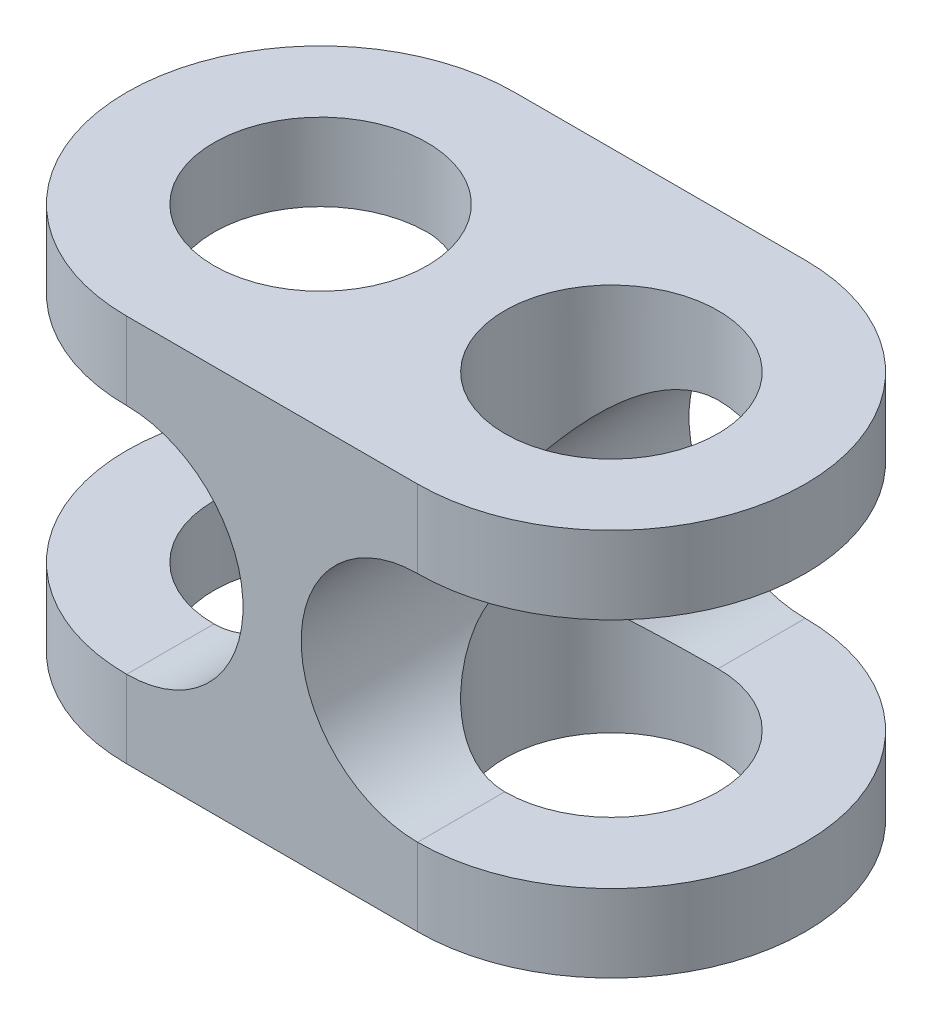
from build123d import *

# Parameters (mm, degrees)
SKETCH1_R                      = 2.75
BOSS_EXTRUDE1_DEPTH            = 10
CUT_EXTRUDE1_REACH             = 18.771
CUT_EXTRUDE1_DIRECTION_2_REACH = 18.771


with BuildPart() as part:
    # Sketch1 → Boss-Extrude1 (new body)
    with BuildSketch(Plane(origin=(0, 0, 0), x_dir=(1, 0, 0), z_dir=(0, 1, 0))):
        with BuildLine():
            Line((0, 5), (7.5, 5))
            ThreePointArc((7.5, 5), (12.5, 0), (7.5, -5))
            Line((7.5, -5), (0, -5))
            ThreePointArc((0, -5), (-5, 0), (0, 5))
        make_face()
        Circle(SKETCH1_R, mode=Mode.SUBTRACT)
        with Locations((7.5, 0)):
            Circle(SKETCH1_R, mode=Mode.SUBTRACT)
    extrude(amount=BOSS_EXTRUDE1_DEPTH)

    # Sketch2 → Cut-Extrude1 (cut, up to next)
    with BuildSketch(Plane.XY, mode=Mode.PRIVATE) as cut_extrude1_sk1:
        with BuildLine():
            Line((0, 8), (-5, 8))
            Line((-5, 8), (-5, 2))
            Line((-5, 2), (0, 2))
            ThreePointArc((0, 2), (3, 5), (0, 8))
        make_face()
    cut_extrude1_tool1 = extrude(cut_extrude1_sk1.sketch, amount=-CUT_EXTRUDE1_REACH, mode=Mode.PRIVATE) & part.part
    # Sketch2 → Cut-Extrude1 (cut, up to next)
    with BuildSketch(Plane.XY, mode=Mode.PRIVATE) as cut_extrude1_sk2:
        with BuildLine():
            Line((7.5, 8), (12.5, 8))
            Line((12.5, 8), (12.5, 2))
            Line((12.5, 2), (7.5, 2))
            ThreePointArc((7.5, 2), (4.5, 5), (7.5, 8))
        make_face()
    cut_extrude1_tool2 = extrude(cut_extrude1_sk2.sketch, amount=-CUT_EXTRUDE1_REACH, mode=Mode.PRIVATE) & part.part
    add(cut_extrude1_tool1.solids().sort_by_distance((-1.291429, 5, 0))[0], mode=Mode.SUBTRACT)
    add(cut_extrude1_tool2.solids().sort_by_distance((8.791429, 5, 0))[0], mode=Mode.SUBTRACT)

    # Sketch2 → Cut-Extrude1 direction 2 (cut, up to next)
    with BuildSketch(Plane.XY, mode=Mode.PRIVATE) as cut_extrude1_direction_2_sk1:
        with BuildLine():
            Line((0, 8), (-5, 8))
            Line((-5, 8), (-5, 2))
            Line((-5, 2), (0, 2))
            ThreePointArc((0, 2), (3, 5), (0, 8))
        make_face()
    cut_extrude1_direction_2_tool1 = extrude(cut_extrude1_direction_2_sk1.sketch, amount=CUT_EXTRUDE1_DIRECTION_2_REACH, mode=Mode.PRIVATE) & part.part
    # Sketch2 → Cut-Extrude1 direction 2 (cut, up to next)
    with BuildSketch(Plane.XY, mode=Mode.PRIVATE) as cut_extrude1_direction_2_sk2:
        with BuildLine():
            Line((7.5, 8), (12.5, 8))
            Line((12.5, 8), (12.5, 2))
            Line((12.5, 2), (7.5, 2))
            ThreePointArc((7.5, 2), (4.5, 5), (7.5, 8))
        make_face()
    cut_extrude1_direction_2_tool2 = extrude(cut_extrude1_direction_2_sk2.sketch, amount=CUT_EXTRUDE1_DIRECTION_2_REACH, mode=Mode.PRIVATE) & part.part
    add(cut_extrude1_direction_2_tool1.solids().sort_by_distance((-1.291429, 5, 0))[0], mode=Mode.SUBTRACT)
    add(cut_extrude1_direction_2_tool2.solids().sort_by_distance((8.791429, 5, 0))[0], mode=Mode.SUBTRACT)


solid = part.part
